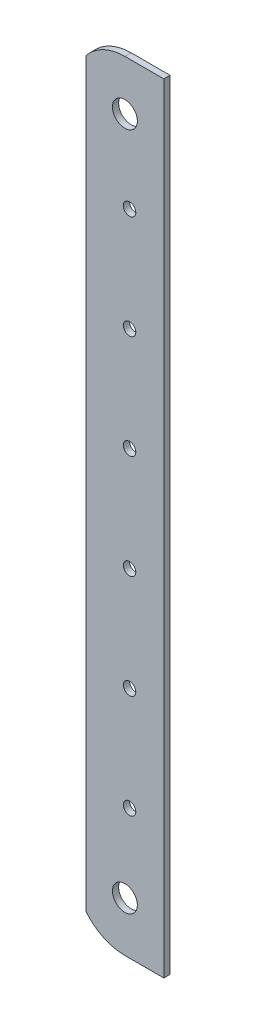
from build123d import *

# Parameters (mm, degrees)
SKETCH1_R           = 4
BOSS_EXTRUDE1_DEPTH = 2
SKETCH2_R           = 2
CUT_EXTRUDE1_DEPTH  = 2


with BuildPart() as part:
    # Sketch1 → Boss-Extrude1 (new body)
    with BuildSketch(Plane.XY):
        with BuildLine():
            Line((3.5, 125), (12.5, 125))
            Line((12.5, 125), (12.5, -125))
            Line((12.5, -125), (3.5, -125))
            Line((3.5, -125), (0, -125))
            ThreePointArc((0, -125), (-6.935420865, -123.418735639), (-12.5, -118.987492178))
            Line((-12.5, -118.987492178), (-12.5, -109))
            Line((-12.5, -109), (-12.5, 109))
            Line((-12.5, 109), (-12.5, 118.987492178))
            ThreePointArc((-12.5, 118.987492178), (-6.935420865, 123.418735639), (0, 125))
            Line((0, 125), (3.5, 125))
        make_face()
        with Locations((0, 109)):
            Circle(SKETCH1_R, mode=Mode.SUBTRACT)
        with Locations((0, -109)):
            Circle(SKETCH1_R, mode=Mode.SUBTRACT)
    extrude(amount=BOSS_EXTRUDE1_DEPTH)

    # Sketch2 → Cut-Extrude1 (cut)
    with BuildSketch(Plane.XY.offset(2)):
        with Locations((1.5, 83.3)):
            Circle(SKETCH2_R)
        with Locations((1.5, 50)):
            Circle(SKETCH2_R)
        with Locations((1.5, 16.7)):
            Circle(SKETCH2_R)
        with Locations((1.5, -16.7)):
            Circle(SKETCH2_R)
        with Locations((1.5, -50)):
            Circle(SKETCH2_R)
        with Locations((1.5, -83.3)):
            Circle(SKETCH2_R)
    extrude(amount=-CUT_EXTRUDE1_DEPTH, mode=Mode.SUBTRACT)


solid = part.part
